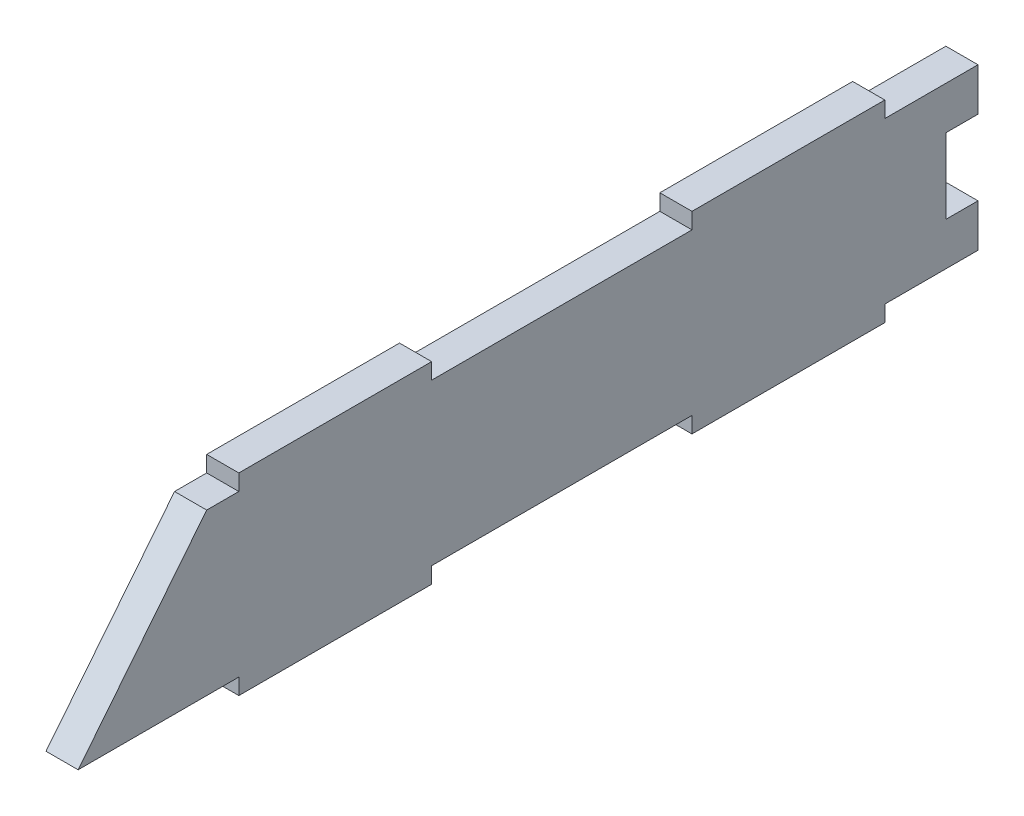
from build123d import *

# Parameters (mm, degrees)
SKETCH1_W               = 355.6
SKETCH1_H               = 63.5
BOSS_EXTRUDE1_DEPTH     = 12.7
CUT_EXTRUDE1_DEPTH      = 182.058533353
CUT_EXTRUDE1_DEPTH_BACK = 182.058533353
SKETCH3_W               = 76.2
SKETCH3_H               = 6.35
BOSS_EXTRUDE2_DEPTH     = 12.7
SKETCH4_W               = 12.7
SKETCH4_H               = 29.633333249
CUT_EXTRUDE2_DEPTH      = 183.279291199


with BuildPart() as part:
    # Sketch1 → Boss-Extrude1 (new body)
    with BuildSketch(Plane(origin=(0, 0, 0), x_dir=(0, 0, -1), z_dir=(1, 0, 0))):
        Rectangle(SKETCH1_W, SKETCH1_H)
    extrude(amount=BOSS_EXTRUDE1_DEPTH)

    # Sketch2 → Cut-Extrude1 (cut, two sides: drawn at the far end of the back side and taken through both)
    with BuildSketch(Plane(origin=(12.7, 0, 0), x_dir=(0, 0, -1), z_dir=(1, 0, 0)).offset(-CUT_EXTRUDE1_DEPTH_BACK)):
        Polygon((-635.358076732, -603.697595915), (-177.8, -31.75), (-127, 31.75), (330.558076732, 603.697595915), (-813.337115098, 1518.813749379), (-1779.253268562, 311.418557549), align=None)
    extrude(amount=CUT_EXTRUDE1_DEPTH + CUT_EXTRUDE1_DEPTH_BACK, mode=Mode.SUBTRACT)

    # Sketch3 → Boss-Extrude2 (add)
    with BuildSketch(Plane.ZY):
        with Locations((-102.87, -34.925)):
            Rectangle(SKETCH3_W, SKETCH3_H)
        with Locations((76.2, -34.925)):
            Rectangle(SKETCH3_W, SKETCH3_H)
        with Locations((-102.87, 34.925)):
            Rectangle(SKETCH3_W, SKETCH3_H)
        with Locations((76.2, 34.925)):
            Rectangle(SKETCH3_W, SKETCH3_H)
    extrude(amount=-BOSS_EXTRUDE2_DEPTH)

    # Sketch4 → Cut-Extrude2 (cut, through all)
    with BuildSketch(Plane.ZY):
        with Locations((-171.45, -4.2e-08)):
            Rectangle(SKETCH4_W, SKETCH4_H)
    extrude(amount=-CUT_EXTRUDE2_DEPTH, mode=Mode.SUBTRACT)


solid = part.part
